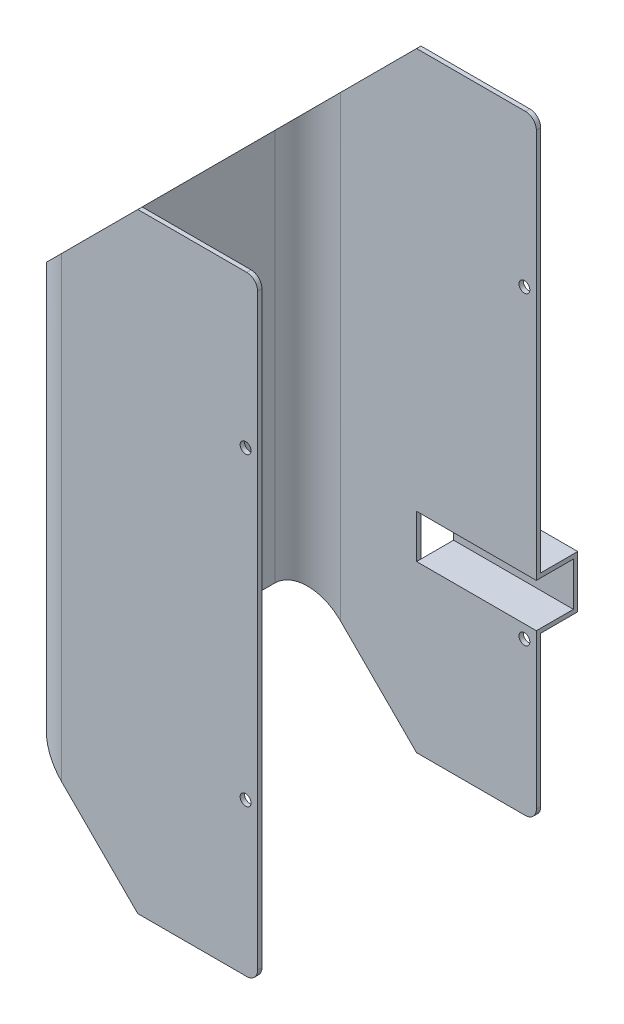
from build123d import *

# Parameters (mm, degrees)
SM_BASE_FLANGE_1_DEPTH = 280
SKETCH_3_R             = 2.5
CUT_EXTRUDE_2_DEPTH    = 327.075144714
CUT_EXTRUDE_3_DEPTH    = 327.075144714
FILLET_1_R             = 5
SKETCH_5_W             = 55
SKETCH_5_H             = 20
CUT_EXTRUDE_4_DEPTH    = 2
EXTRUDE_1_DEPTH        = 55


# Sheet-metal steps are written as plain solids
with BuildPart() as part:
    # Sketch 1 → 基体-法兰1 (new body)
    with BuildSketch(Plane(origin=(0, 0, 0), x_dir=(1, 0, 0), z_dir=(0, 1, 0))):
        with BuildLine():
            Line((105, 63), (15, 63))
            ThreePointArc((15, 63), (4.393398282, 58.606601718), (0, 48))
            Line((0, 48), (0, -48))
            ThreePointArc((0, -48), (4.393398282, -58.606601718), (15, -63))
            Line((15, -63), (105, -63))
            Line((105, -63), (105, -65))
            Line((105, -65), (15, -65))
            ThreePointArc((15, -65), (2.97918472, -60.02081528), (-2, -48))
            Line((-2, -48), (-2, 48))
            ThreePointArc((-2, 48), (2.97918472, 60.02081528), (15, 65))
            Line((15, 65), (105, 65))
            Line((105, 65), (105, 63))
        make_face()
    extrude(amount=SM_BASE_FLANGE_1_DEPTH)

    # 草图3 → 切除-拉伸2 (cut, through all)
    with BuildSketch(Plane.XY.offset(65)):
        with Locations((99.5, 210)):
            Circle(SKETCH_3_R)
        with Locations((99.5, 70)):
            Circle(SKETCH_3_R)
    extrude(amount=-CUT_EXTRUDE_2_DEPTH, mode=Mode.SUBTRACT)

    # 草图4 → 切除-拉伸3 (cut, through all)
    with BuildSketch(Plane.XY.offset(65)):
        Polygon((50, 280), (-2, 228), (-2, 280), align=None)
        Polygon((-2, 52), (-2, 0), (50, 0), align=None)
    extrude(amount=-CUT_EXTRUDE_3_DEPTH, mode=Mode.SUBTRACT)

    # 圆角1
    fillet_1_edges = [part.edges().sort_by_distance(p)[0] for p in [
        (105, 0, 64),
        (105, 0, -64),
        (105, 280, 64),
        (105, 280, -64),
    ]]
    fillet(fillet_1_edges, radius=FILLET_1_R)

    # 草图5 → 切除-拉伸4 (cut)
    with BuildSketch(Plane(origin=(0, 0, -65), x_dir=(-1, 0, 0), z_dir=(0, 0, -1))):
        with Locations((-77.5, 86)):
            Rectangle(SKETCH_5_W, SKETCH_5_H)
    extrude(amount=-CUT_EXTRUDE_4_DEPTH, mode=Mode.SUBTRACT)

    # 草图6 → 凸台-拉伸1 (add)
    with BuildSketch(Plane(origin=(50, 0, 0), x_dir=(0, 0, -1), z_dir=(1, 0, 0))):
        Polygon((65, 96), (80, 96), (80, 76), (65, 76), (65, 74), (82, 74), (82, 98), (65, 98), align=None)
    extrude(amount=EXTRUDE_1_DEPTH)


solid = part.part
